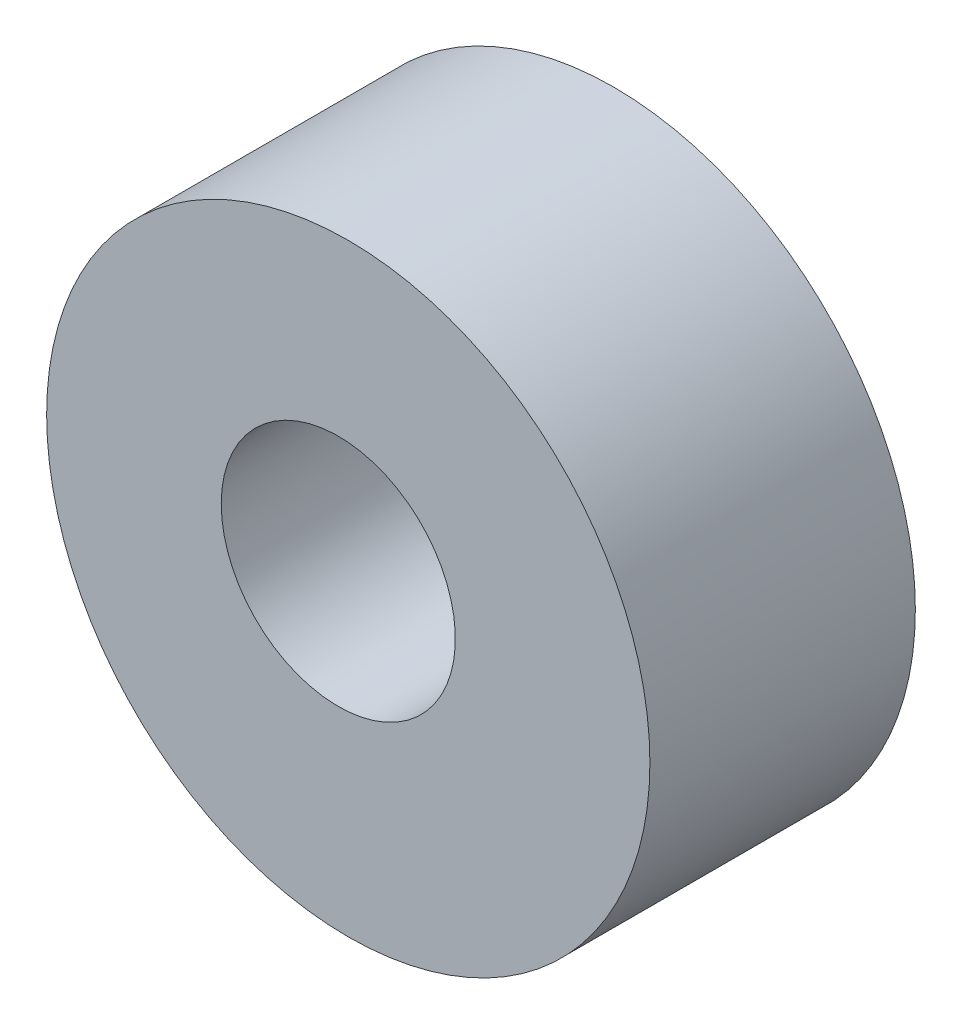
from build123d import *

# Parameters (mm, degrees)
SKETCH1_R           = 6.35
BOSS_EXTRUDE1_DEPTH = 5.588
CAVITY1_OUTLINE_R   = 2.464308
CAVITY1_DEPTH       = 5.588


# Read off the part's stored shape, not the designer's step: Cavity1
with BuildPart() as part:
    # Sketch1 → Boss-Extrude1 (new body)
    with BuildSketch(Plane.XY):
        Circle(SKETCH1_R)
    extrude(amount=BOSS_EXTRUDE1_DEPTH)

    # Cavity1 outline → Cavity1 (cut)
    with BuildSketch(Plane.XY):
        with Locations((-0.210185, 0.210789276)):
            Circle(CAVITY1_OUTLINE_R)
    extrude(amount=CAVITY1_DEPTH, mode=Mode.SUBTRACT)


solid = part.part
